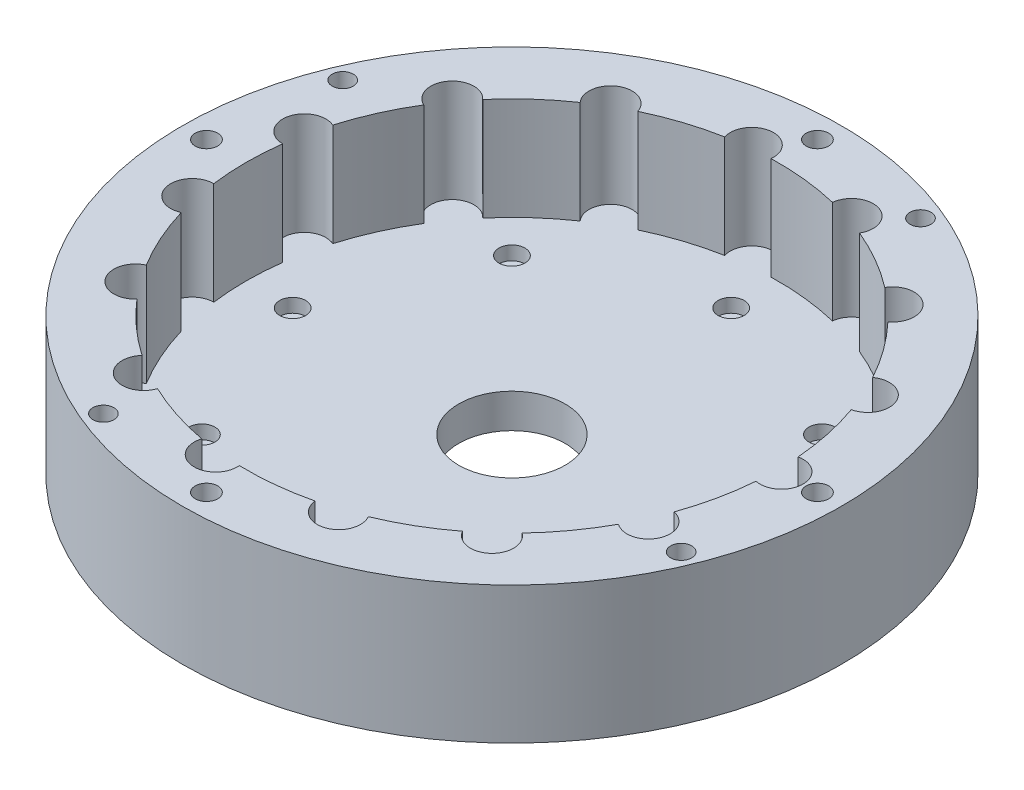
from build123d import *

# Parameters (mm, degrees)
SKETCH1_R           = 45.85
SKETCH1_R_2         = 1.5635
SKETCH1_R_3         = 7.4
BOSS_EXTRUDE1_DEPTH = 4.7625
SKETCH1_6_R         = 1.8125
CUT_EXTRUDE1_DEPTH  = 1.9125
BOSS_EXTRUDE2_START = 14.2875
SKETCH1_7_R         = 45.85
SKETCH1_7_R_2       = 1.5635
BOSS_EXTRUDE2_DEPTH = 14.2875
SKETCH3_R           = 1.46
CUT_EXTRUDE5_DEPTH  = 68.582153709


with BuildPart() as part:
    # Sketch1 → Boss-Extrude1 (new body)
    with BuildSketch(Plane(origin=(0, 0, 0), x_dir=(1, 0, 0), z_dir=(0, 1, 0))):
        Circle(SKETCH1_R)
        with Locations((0, -42.5)):
            Circle(SKETCH1_R_2, mode=Mode.SUBTRACT)
        with Locations((-42.5, 0)):
            Circle(SKETCH1_R_2, mode=Mode.SUBTRACT)
        with Locations((42.5, 0)):
            Circle(SKETCH1_R_2, mode=Mode.SUBTRACT)
        with Locations((0, 42.5)):
            Circle(SKETCH1_R_2, mode=Mode.SUBTRACT)
        Circle(SKETCH1_R_3, mode=Mode.SUBTRACT)
    extrude(amount=-BOSS_EXTRUDE1_DEPTH)

    # Sketch1<6> → Cut-Extrude1 (cut)
    with BuildSketch(Plane(origin=(0, 0, 0), x_dir=(1, 0, 0), z_dir=(0, 1, 0))):
        with Locations((30.5, 0)):
            Circle(SKETCH1_6_R)
        with Locations((21.566756826, -21.566756826)):
            Circle(SKETCH1_6_R)
        with Locations((0, -30.5)):
            Circle(SKETCH1_6_R)
        with Locations((-21.566756826, -21.566756826)):
            Circle(SKETCH1_6_R)
        with Locations((-30.5, 0)):
            Circle(SKETCH1_6_R)
        with Locations((-21.566756826, 21.566756826)):
            Circle(SKETCH1_6_R)
        with Locations((0, 30.5)):
            Circle(SKETCH1_6_R)
        with Locations((21.566756826, 21.566756826)):
            Circle(SKETCH1_6_R)
    extrude(amount=-CUT_EXTRUDE1_DEPTH, mode=Mode.SUBTRACT)

    # Sketch1<7> → Boss-Extrude2 (add)
    with BuildSketch(Plane(origin=(0, 0, 0), x_dir=(1, 0, 0), z_dir=(0, 1, 0)).offset(BOSS_EXTRUDE2_START)):
        Circle(SKETCH1_7_R)
        with Locations((0, -42.5)):
            Circle(SKETCH1_7_R_2, mode=Mode.SUBTRACT)
        with Locations((-42.5, 0)):
            Circle(SKETCH1_7_R_2, mode=Mode.SUBTRACT)
        with Locations((42.5, 0)):
            Circle(SKETCH1_7_R_2, mode=Mode.SUBTRACT)
        with BuildLine():
            ThreePointArc((36.883333333, 2.935936345), (39.39076704, 2.32916294), (40.5, 0))
            ThreePointArc((40.5, 0), (39.39076704, -2.32916294), (36.883333333, -2.935936345))
            ThreePointArc((36.883333333, -2.935936345), (36.191461227, -7.69273256), (34.888754523, -12.319691873))
            ThreePointArc((34.888754523, -12.319691873), (36.59166411, -13.367471546), (37.257954662, -15.252624115))
            ThreePointArc((37.257954662, -15.252624115), (35.6231437, -17.924001829), (32.500448736, -17.683914497))
            ThreePointArc((32.500448736, -17.683914497), (29.933628792, -21.748054335), (26.861593101, -25.445133446))
            ThreePointArc((26.861593101, -25.445133446), (27.767055295, -26.50917897), (28.092397738, -27.867930955))
            ThreePointArc((28.092397738, -27.867930955), (25.872343464, -30.764771418), (22.497941295, -29.37418318))
            ThreePointArc((22.497941295, -29.37418318), (18.5, -32.04293994), (14.189818202, -34.170880284))
            ThreePointArc((14.189818202, -34.170880284), (14.486847583, -34.891651942), (14.588137289, -35.664619361))
            ThreePointArc((14.588137289, -35.664619361), (11.748752331, -38.660316744), (8.605335417, -35.985388734))
            ThreePointArc((8.605335417, -35.985388734), (3.867553141, -36.797310129), (-0.935505175, -36.988171489))
            ThreePointArc((-0.935505175, -36.988171489), (-0.92374189, -37.141170608), (-0.919817373, -37.294571076))
            ThreePointArc((-0.919817373, -37.294571076), (-4.385552663, -40.258199029), (-6.775211132, -36.37439366))
            ThreePointArc((-6.775211132, -36.37439366), (-11.433628792, -35.189091103), (-15.899071208, -33.409871815))
            ThreePointArc((-15.899071208, -33.409871815), (-20.25, -35.074028853), (-20.984262125, -30.47393547))
            ThreePointArc((-20.984262125, -30.47393547), (-24.757832435, -27.496358543), (-28.113543391, -24.054701786))
            ThreePointArc((-28.113543391, -24.054701786), (-32.765188272, -23.805302718), (-31.564943561, -19.304256991))
            ThreePointArc((-31.564943561, -19.304256991), (-33.801181933, -15.049255794), (-35.466928517, -10.540255288))
            ThreePointArc((-35.466928517, -10.540255288), (-39.61497783, -8.420423478), (-36.687759497, -4.796697105))
            ThreePointArc((-36.687759497, -4.796697105), (-37, 0), (-36.687759497, 4.796697105))
            ThreePointArc((-36.687759497, 4.796697105), (-39.61497783, 8.420423478), (-35.466928517, 10.540255288))
            ThreePointArc((-35.466928517, 10.540255288), (-33.801181933, 15.049255794), (-31.564943561, 19.304256991))
            ThreePointArc((-31.564943561, 19.304256991), (-32.765188272, 23.805302718), (-28.113543391, 24.054701786))
            ThreePointArc((-28.113543391, 24.054701786), (-24.757832435, 27.496358543), (-20.984262125, 30.47393547))
            ThreePointArc((-20.984262125, 30.47393547), (-20.25, 35.074028853), (-15.899071208, 33.409871815))
            ThreePointArc((-15.899071208, 33.409871815), (-11.433628792, 35.189091103), (-6.775211132, 36.37439366))
            ThreePointArc((-6.775211132, 36.37439366), (-4.385552663, 40.258199029), (-0.919817373, 37.294571076))
            ThreePointArc((-0.919817373, 37.294571076), (-0.92374189, 37.141170608), (-0.935505175, 36.988171489))
            ThreePointArc((-0.935505175, 36.988171489), (3.867553141, 36.797310129), (8.605335417, 35.985388734))
            ThreePointArc((8.605335417, 35.985388734), (11.748752331, 38.660316744), (14.588137289, 35.664619361))
            ThreePointArc((14.588137289, 35.664619361), (14.486847583, 34.891651942), (14.189818202, 34.170880284))
            ThreePointArc((14.189818202, 34.170880284), (18.5, 32.04293994), (22.497941295, 29.37418318))
            ThreePointArc((22.497941295, 29.37418318), (25.872343464, 30.764771418), (28.092397738, 27.867930955))
            ThreePointArc((28.092397738, 27.867930955), (27.767055295, 26.50917897), (26.861593101, 25.445133446))
            ThreePointArc((26.861593101, 25.445133446), (29.933628792, 21.748054335), (32.500448736, 17.683914497))
            ThreePointArc((32.500448736, 17.683914497), (35.6231437, 17.924001829), (37.257954662, 15.252624115))
            ThreePointArc((37.257954662, 15.252624115), (36.59166411, 13.367471546), (34.888754523, 12.319691873))
            ThreePointArc((34.888754523, 12.319691873), (36.191461227, 7.69273256), (36.883333333, 2.935936345))
        make_face(mode=Mode.SUBTRACT)
        with Locations((0, 42.5)):
            Circle(SKETCH1_7_R_2, mode=Mode.SUBTRACT)
    extrude(amount=-BOSS_EXTRUDE2_DEPTH)

    # Sketch3 → Cut-Extrude5 (cut, through all)
    with BuildSketch(Plane(origin=(0, 14.2875, 0), x_dir=(1, 0, 0), z_dir=(0, 1, 0))):
        with Locations((-40.188759664, 16.646729308)):
            Circle(SKETCH3_R)
        with Locations((16.646729308, 40.188759664)):
            Circle(SKETCH3_R)
        with Locations((40.188759664, -16.646729308)):
            Circle(SKETCH3_R)
        with Locations((-16.646729308, -40.188759664)):
            Circle(SKETCH3_R)
    extrude(amount=-CUT_EXTRUDE5_DEPTH, mode=Mode.SUBTRACT)


solid = part.part
